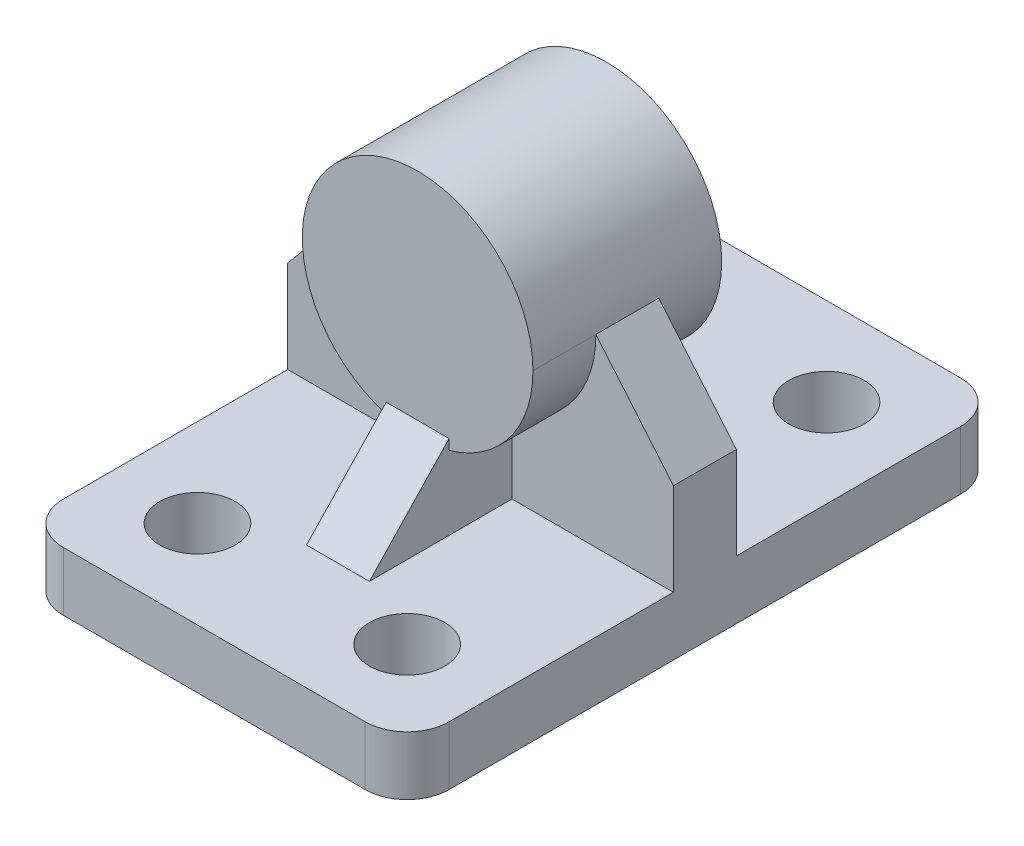
from build123d import *

# Parameters (mm, degrees)
BOSS_EXTRUDE1_DEPTH      = 46
BOSS_EXTRUDE1_DEPTH_BACK = 46
SKETCH1_W                = 142
SKETCH1_H                = 14
BOSS_EXTRUDE2_DEPTH      = 22.5
BOSS_EXTRUDE2_DEPTH_BACK = 22.5
SKETCH2_R                = 27.5
BOSS_EXTRUDE3_DEPTH      = 7.5
BOSS_EXTRUDE3_DEPTH_BACK = 7.5
BOSS_EXTRUDE7_DEPTH      = 7.5
BOSS_EXTRUDE7_DEPTH_BACK = 7.5
HOLE1_D                  = 18
FILLET1_R                = 10


with BuildPart() as part:
    # Sketch1 → Boss-Extrude1 (new, two sides: drawn at the far end of the back side and taken through both)
    with BuildSketch(Plane(origin=(0, 0, 0), x_dir=(0, 0, -1), z_dir=(1, 0, 0)).offset(-BOSS_EXTRUDE1_DEPTH_BACK)):
        with Locations((0, 7)):
            Rectangle(SKETCH1_W, SKETCH1_H)
    extrude(amount=BOSS_EXTRUDE1_DEPTH + BOSS_EXTRUDE1_DEPTH_BACK)



with BuildPart() as body_2:
    # Sketch2 → Boss-Extrude2 (new, two sides: drawn at the far end of the back side and taken through both)
    with BuildSketch(Plane.XY.offset(-BOSS_EXTRUDE2_DEPTH_BACK)):
        with Locations((0, 58)):
            Circle(SKETCH2_R)
    extrude(amount=BOSS_EXTRUDE2_DEPTH + BOSS_EXTRUDE2_DEPTH_BACK)


with BuildPart() as part_1:
    add(part.part)

    add(body_2.part)  # Boss-Extrude3 merges body 2
    # Sketch3 → Boss-Extrude3 (add, two sides: drawn at the far end of the back side and taken through both)
    with BuildSketch(Plane.XY.offset(-BOSS_EXTRUDE3_DEPTH_BACK)):
        Polygon((-46, 36), (-27.5, 58), (27.5, 58), (46, 36), (46, 14), (-46, 14), align=None)
    extrude(amount=BOSS_EXTRUDE3_DEPTH + BOSS_EXTRUDE3_DEPTH_BACK)

    # Sketch4 → Boss-Extrude7 (add, two sides: drawn at the far end of the back side and taken through both)
    with BuildSketch(Plane(origin=(0, 0, 0), x_dir=(0, 0, -1), z_dir=(1, 0, 0)).offset(-BOSS_EXTRUDE7_DEPTH_BACK)):
        Polygon((-41.5, 14), (-22.5, 34), (-22.5, 31.5), (-7.5, 31.5), (-7.5, 14), align=None)
    extrude(amount=BOSS_EXTRUDE7_DEPTH + BOSS_EXTRUDE7_DEPTH_BACK)

    # Hole1 (through all)
    with Locations(Plane(origin=(0, 14, 0), x_dir=(1, 0, 0), z_dir=(0, 1, 0))):
        with Locations((25, -50), (-25, -50), (-25, 50), (25, 50)):
            Hole(HOLE1_D / 2)

    # Fillet1
    fillet1_edges = [part_1.edges().sort_by_distance(p)[0] for p in [
        (-46, 7, -71),
        (46, 7, -71),
        (46, 7, 71),
        (-46, 7, 71),
    ]]
    fillet(fillet1_edges, radius=FILLET1_R)


solid = part_1.part
